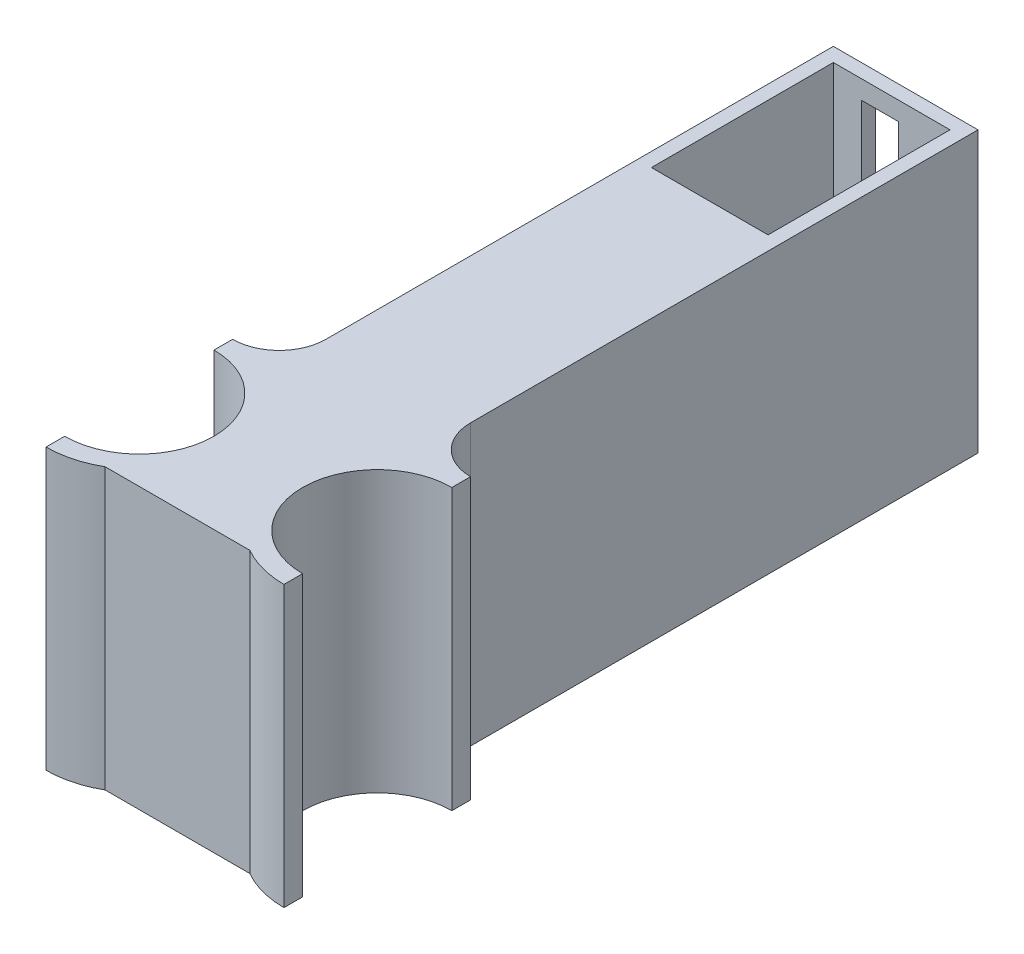
from build123d import *

# Parameters (mm, degrees)
SKETCH1_W           = 31
SKETCH1_H           = 45
SKETCH1_W_2         = 25
SKETCH1_H_2         = 39
BOSS_EXTRUDE1_DEPTH = 60
BOSS_EXTRUDE3_DEPTH = 60
SKETCH3_W           = 8
SKETCH3_H           = 52
CUT_EXTRUDE1_DEPTH  = 9
FILLET1_R           = 10


with BuildPart() as part:
    # Sketch1 → Boss-Extrude1 (new body)
    with BuildSketch(Plane(origin=(0, 0, 0), x_dir=(1, 0, 0), z_dir=(0, 1, 0))):
        Rectangle(SKETCH1_W, SKETCH1_H)
        Rectangle(SKETCH1_W_2, SKETCH1_H_2, mode=Mode.SUBTRACT)
    extrude(amount=BOSS_EXTRUDE1_DEPTH)

    # Sketch5 → Boss-Extrude3 (add)
    with BuildSketch(Plane(origin=(0, 60, 0), x_dir=(1, 0, 0), z_dir=(0, 1, 0))):
        with BuildLine():
            ThreePointArc((-25.5, -136.257439501), (-20.323619098, -135.575956026), (-15.5, -133.577947576))
            Line((-15.5, -133.577947576), (15.5, -133.577947576))
            ThreePointArc((15.5, -133.577947576), (20.323619098, -135.575956026), (25.5, -136.257439501))
            Line((25.5, -136.257439501), (25.5, -132.257439501))
            ThreePointArc((25.5, -132.257439501), (9.5, -116.257439501), (25.5, -100.257439501))
            Line((25.5, -100.257439501), (25.5, -96.257439501))
            ThreePointArc((25.5, -96.257439501), (20.323619098, -96.938922975), (15.5, -98.936931425))
            Line((15.5, -98.936931425), (15.5, -22.5))
            Line((15.5, -22.5), (-15.5, -22.5))
            Line((-15.5, -22.5), (-15.5, -98.936931425))
            ThreePointArc((-15.5, -98.936931425), (-20.323619098, -96.938922975), (-25.5, -96.257439501))
            Line((-25.5, -96.257439501), (-25.5, -100.257439501))
            ThreePointArc((-25.5, -100.257439501), (-9.5, -116.257439501), (-25.5, -132.257439501))
            Line((-25.5, -132.257439501), (-25.5, -136.257439501))
        make_face()
    extrude(amount=-BOSS_EXTRUDE3_DEPTH)

    # Sketch3 → Cut-Extrude1 (cut)
    with BuildSketch(Plane(origin=(0, 0, -22.5), x_dir=(-1, 0, 0), z_dir=(0, 0, -1))):
        with Locations((2.5, 30)):
            Rectangle(SKETCH3_W, SKETCH3_H)
    extrude(amount=-CUT_EXTRUDE1_DEPTH, mode=Mode.SUBTRACT)

    # Fillet1
    fillet1_edges = [part.edges().sort_by_distance(p)[0] for p in [
        (-15.5, 30, 98.936931425),
        (15.5, 30, 98.936931425),
    ]]
    fillet(fillet1_edges, radius=FILLET1_R - 0.0001)  # a hair under: the kernel refuses the full size


solid = part.part
